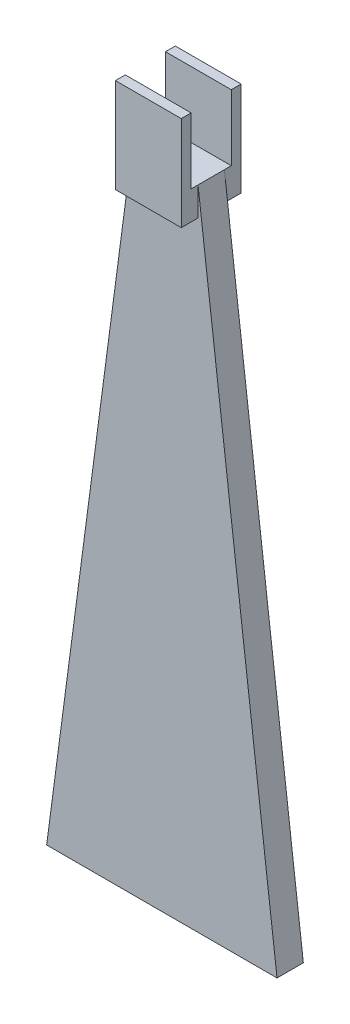
from build123d import *

# Parameters (mm, degrees)
BOSS_EXTRUDE1_DEPTH = 4
BOSS_EXTRUDE2_START = 188
SKETCH2_W           = 20
SKETCH2_H           = 18.2
BOSS_EXTRUDE2_DEPTH = 8.7
BOSS_EXTRUDE3_START = 196.7
SKETCH3_W           = 20
SKETCH3_H           = 3
BOSS_EXTRUDE3_DEPTH = 20


with BuildPart() as part:
    # Sketch1 → Boss-Extrude1 (new, symmetric)
    with BuildSketch(Plane.XY):
        Polygon((-115, 0), (-45, 0), (-69, 196.7), (-89, 196.7), align=None)
    extrude(amount=BOSS_EXTRUDE1_DEPTH, both=True)

    # Sketch2 → Boss-Extrude2 (add)
    with BuildSketch(Plane(origin=(0, 0, 0), x_dir=(1, 0, 0), z_dir=(0, 1, 0)).offset(BOSS_EXTRUDE2_START)):
        with Locations((-79, 0)):
            Rectangle(SKETCH2_W, SKETCH2_H)
    extrude(amount=BOSS_EXTRUDE2_DEPTH)

    # Sketch3 → Boss-Extrude3 (add)
    with BuildSketch(Plane(origin=(0, 0, 0), x_dir=(1, 0, 0), z_dir=(0, 1, 0)).offset(BOSS_EXTRUDE3_START)):
        with Locations((-79, 7.6)):
            Rectangle(SKETCH3_W, SKETCH3_H)
        with Locations((-79, -7.6)):
            Rectangle(SKETCH3_W, SKETCH3_H)
    extrude(amount=BOSS_EXTRUDE3_DEPTH)


solid = part.part
